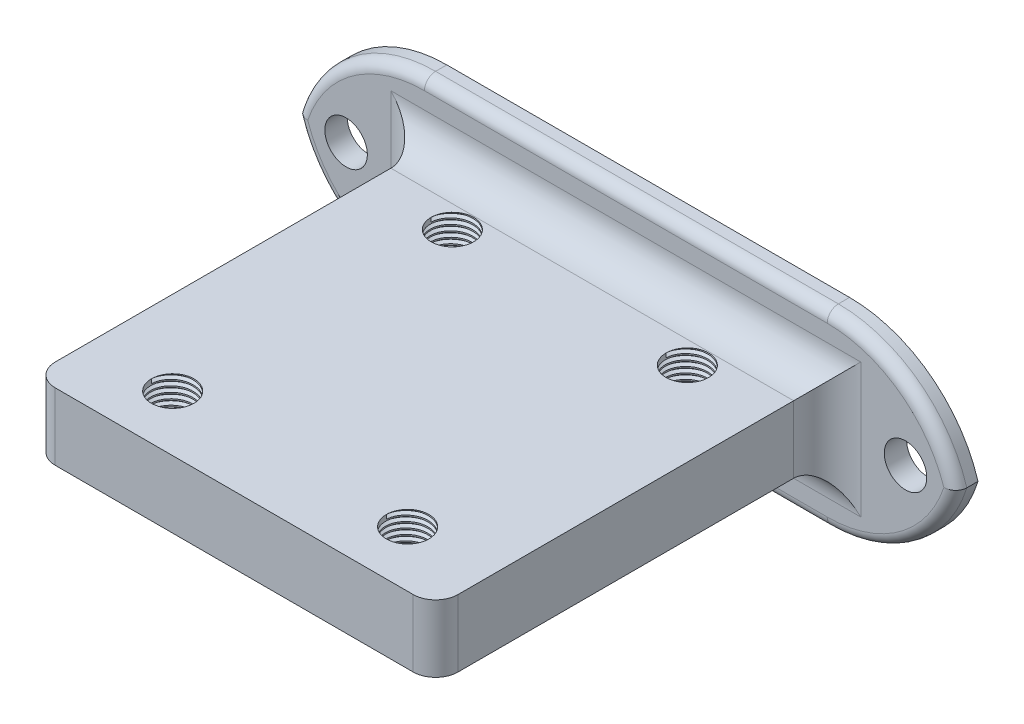
from build123d import *

# Parameters (mm, degrees)
CROQUIS1_W              = 36
CROQUIS1_H              = 6
SALIENTE_EXTRUIR1_DEPTH = 35
CROQUIS3_R              = 1.9
CORTAR_EXTRUIR1_DEPTH   = 40.812058475
CROQUIS4_W              = 60
CROQUIS4_H              = 17
SALIENTE_EXTRUIR2_DEPTH = 2
REDONDEO1_R             = 2
CROQUIS5_R              = 1.9
CORTAR_EXTRUIR2_DEPTH   = 47.874833333
REDONDEO2_R             = 3
REDONDEO4_R             = 12
REDONDEO3_R             = 1
ROSCA1_PITCH            = 0.5
ROSCA2_PITCH            = 0.5
ROSCA3_PITCH            = 0.5
ROSCA4_PITCH            = 0.5


with BuildPart() as part:
    # Croquis1 → Saliente-Extruir1 (new body)
    with BuildSketch(Plane.XY):
        Rectangle(CROQUIS1_W, CROQUIS1_H)
    extrude(amount=SALIENTE_EXTRUIR1_DEPTH)

    # Croquis3 → Cortar-Extruir1 (cut, through all)
    with BuildSketch(Plane.XZ.offset(3)):
        with Locations((-10.5, 30)):
            Circle(CROQUIS3_R)
        with Locations(Location((-10.5, 5, 0), (0, 0, 180))):
            Circle(CROQUIS3_R)
        with Locations((10.5, 5)):
            Circle(CROQUIS3_R)
        with Locations(Location((10.5, 30, 0), (0, 0, 180))):
            Circle(CROQUIS3_R)
    extrude(amount=-CORTAR_EXTRUIR1_DEPTH, mode=Mode.SUBTRACT)

    # Croquis4 → Saliente-Extruir2 (add)
    with BuildSketch(Plane(origin=(0, 0, -2), x_dir=(-1, 0, 0), z_dir=(0, 0, -1))):
        Rectangle(CROQUIS4_W, CROQUIS4_H)
    extrude(amount=-SALIENTE_EXTRUIR2_DEPTH)

    # Redondeo1
    redondeo1_edges = [part.edges().sort_by_distance(p)[0] for p in [
        (18, 0, 35),
        (-18, 0, 35),
    ]]
    fillet(redondeo1_edges, radius=REDONDEO1_R)

    # Croquis5 → Cortar-Extruir2 (cut, through all)
    with BuildSketch(Plane.XY):
        with Locations(Location((25, 0, 0), (0, 0, 180))):
            Circle(CROQUIS5_R)
        with Locations((-25, 0)):
            Circle(CROQUIS5_R)
    extrude(amount=-CORTAR_EXTRUIR2_DEPTH, mode=Mode.SUBTRACT)

    # Redondeo2
    redondeo2_edges = [part.edges().sort_by_distance(p)[0] for p in [
        (0, 3, 0),
        (18, 0, 0),
        (0, -3, 0),
        (-18, 0, 0),
    ]]
    fillet(redondeo2_edges, radius=REDONDEO2_R)

    # Redondeo4
    # the kernel refuses this fillet: 12 mm, written as the material it takes off along each edge
    with BuildSketch(Plane(origin=(-30, -8.5, -32), x_dir=(0, 1, 0), z_dir=(0, 0, 1)), Plane(origin=(-30, 8.5, -32), x_dir=(1, 0, 0), z_dir=(0, 0, 1))) as redondeo4_piece_1:
        with BuildLine():
            CenterArc((REDONDEO4_R, -REDONDEO4_R), REDONDEO4_R, 90, 90)
            Line((0, -REDONDEO4_R), (0, 0))
            Line((0, 0), (REDONDEO4_R, 0))
        make_face()
    extrude(amount=62, mode=Mode.SUBTRACT)
    with BuildSketch(Plane(origin=(30, -8.5, -32), x_dir=(0, 1, 0), z_dir=(0, 0, 1)), Plane(origin=(30, 8.5, -32), x_dir=(-1, 0, 0), z_dir=(0, 0, 1))) as redondeo4_piece_2:
        with BuildLine():
            CenterArc((REDONDEO4_R, REDONDEO4_R), REDONDEO4_R, 180, 90)
            Line((0, REDONDEO4_R), (0, 0))
            Line((0, 0), (REDONDEO4_R, 0))
        make_face()
    extrude(amount=62, mode=Mode.SUBTRACT)

    # Redondeo3
    redondeo3_edges = [part.edges().sort_by_distance(p)[0] for p in [
        (0, -8.5, 0),
        (0, 8.5, 0),
        (25.141428429, 6.143650761, 0),
        (25.141428429, -6.143650761, 0),
        (-25.141428429, 6.143650761, 0),
        (-25.141428429, -6.143650761, 0),
    ]]
    fillet(redondeo3_edges, radius=REDONDEO3_R)

    # Rosca1: the profile of Perfil de rosca1 profile screwed along a right-hand helix of 12 turns, 6 arcs to a turn; built about Z, then put on its axis
    rosca1_z = Axis((0, 0, 0), (0, 0, 1))
    rosca1_corners = [(1.8997, 0, -0.000173205), (2.170632937, 0, 0.156249999), (2.170632937, 0, 0.218749999), (1.8997, 0, 0.375173204)]
    with BuildLine(mode=Mode.PRIVATE) as rosca1_profile:
        Line(rosca1_corners[0], rosca1_corners[1])
        Line(rosca1_corners[1], rosca1_corners[2])
        Line(rosca1_corners[2], rosca1_corners[3])
        Line(rosca1_corners[3], rosca1_corners[0])
    rosca1_cap = Face(rosca1_profile.wire())
    rosca1_turn_angles = [0, 30, 60, 90, 120, 150, 180, 210, 240, 270, 300, 330, 360]
    rosca1_turn_weights = [1, 0.8660254037844387, 1, 0.8660254037844387, 1, 0.8660254037844387, 1, 0.8660254037844387, 1, 0.8660254037844387, 1, 0.8660254037844387, 1]
    rosca1_turn_rails = [Edge.make_bspline([Vector(p[0], p[1], 0).rotate(rosca1_z, rosca1_turn_angles[k]) / rosca1_turn_weights[k] + Vector(0, 0, p[2] + ROSCA1_PITCH * rosca1_turn_angles[k] / 360) for k in range(13)], [0, 0, 0, 1, 1, 2, 2, 3, 3, 4, 4, 5, 5, 6, 6, 6], 2, rosca1_turn_weights) for p in rosca1_corners]
    rosca1_turn_sides = [Face.make_surface_from_curves(rosca1_turn_rails[p[0]], rosca1_turn_rails[p[1]]) for p in [(0, 1), (1, 2), (2, 3), (3, 0)]]
    rosca1 = Plane(origin=(10.5, 3, 30), x_dir=(-1, 0, 0), z_dir=(0, -1, 0)) * Solid(Shell([*[p.moved(Location((0, 0, ROSCA1_PITCH * i))) for i in range(12) for p in rosca1_turn_sides], rosca1_cap, rosca1_cap.rotate(rosca1_z, 4320).moved(Location((0, 0, ROSCA1_PITCH * 4320 / 360)))]))
    add(rosca1, mode=Mode.SUBTRACT)

    # Rosca2: the profile of Perfil de rosca2 profile screwed along a right-hand helix of 12 turns, 6 arcs to a turn; built about Z, then put on its axis
    rosca2_z = Axis((0, 0, 0), (0, 0, 1))
    rosca2_corners = [(1.8997, 0, -0.000173205), (2.170632937, 0, 0.156249999), (2.170632937, 0, 0.218749999), (1.8997, 0, 0.375173204)]
    with BuildLine(mode=Mode.PRIVATE) as rosca2_profile:
        Line(rosca2_corners[0], rosca2_corners[1])
        Line(rosca2_corners[1], rosca2_corners[2])
        Line(rosca2_corners[2], rosca2_corners[3])
        Line(rosca2_corners[3], rosca2_corners[0])
    rosca2_cap = Face(rosca2_profile.wire())
    rosca2_turn_angles = [0, 30, 60, 90, 120, 150, 180, 210, 240, 270, 300, 330, 360]
    rosca2_turn_weights = [1, 0.8660254037844387, 1, 0.8660254037844387, 1, 0.8660254037844387, 1, 0.8660254037844387, 1, 0.8660254037844387, 1, 0.8660254037844387, 1]
    rosca2_turn_rails = [Edge.make_bspline([Vector(p[0], p[1], 0).rotate(rosca2_z, rosca2_turn_angles[k]) / rosca2_turn_weights[k] + Vector(0, 0, p[2] + ROSCA2_PITCH * rosca2_turn_angles[k] / 360) for k in range(13)], [0, 0, 0, 1, 1, 2, 2, 3, 3, 4, 4, 5, 5, 6, 6, 6], 2, rosca2_turn_weights) for p in rosca2_corners]
    rosca2_turn_sides = [Face.make_surface_from_curves(rosca2_turn_rails[p[0]], rosca2_turn_rails[p[1]]) for p in [(0, 1), (1, 2), (2, 3), (3, 0)]]
    rosca2 = Plane(origin=(-10.5, 3, 30), x_dir=(-1, 0, 0), z_dir=(0, -1, 0)) * Solid(Shell([*[p.moved(Location((0, 0, ROSCA2_PITCH * i))) for i in range(12) for p in rosca2_turn_sides], rosca2_cap, rosca2_cap.rotate(rosca2_z, 4320).moved(Location((0, 0, ROSCA2_PITCH * 4320 / 360)))]))
    add(rosca2, mode=Mode.SUBTRACT)

    # Rosca3: the profile of Perfil de rosca3 profile screwed along a right-hand helix of 12 turns, 6 arcs to a turn; built about Z, then put on its axis
    rosca3_z = Axis((0, 0, 0), (0, 0, 1))
    rosca3_corners = [(1.8997, 0, -0.000173205), (2.170632937, 0, 0.156249999), (2.170632937, 0, 0.218749999), (1.8997, 0, 0.375173204)]
    with BuildLine(mode=Mode.PRIVATE) as rosca3_profile:
        Line(rosca3_corners[0], rosca3_corners[1])
        Line(rosca3_corners[1], rosca3_corners[2])
        Line(rosca3_corners[2], rosca3_corners[3])
        Line(rosca3_corners[3], rosca3_corners[0])
    rosca3_cap = Face(rosca3_profile.wire())
    rosca3_turn_angles = [0, 30, 60, 90, 120, 150, 180, 210, 240, 270, 300, 330, 360]
    rosca3_turn_weights = [1, 0.8660254037844387, 1, 0.8660254037844387, 1, 0.8660254037844387, 1, 0.8660254037844387, 1, 0.8660254037844387, 1, 0.8660254037844387, 1]
    rosca3_turn_rails = [Edge.make_bspline([Vector(p[0], p[1], 0).rotate(rosca3_z, rosca3_turn_angles[k]) / rosca3_turn_weights[k] + Vector(0, 0, p[2] + ROSCA3_PITCH * rosca3_turn_angles[k] / 360) for k in range(13)], [0, 0, 0, 1, 1, 2, 2, 3, 3, 4, 4, 5, 5, 6, 6, 6], 2, rosca3_turn_weights) for p in rosca3_corners]
    rosca3_turn_sides = [Face.make_surface_from_curves(rosca3_turn_rails[p[0]], rosca3_turn_rails[p[1]]) for p in [(0, 1), (1, 2), (2, 3), (3, 0)]]
    rosca3 = Plane(origin=(-10.5, 3, 5), x_dir=(-1, 0, 0), z_dir=(0, -1, 0)) * Solid(Shell([*[p.moved(Location((0, 0, ROSCA3_PITCH * i))) for i in range(12) for p in rosca3_turn_sides], rosca3_cap, rosca3_cap.rotate(rosca3_z, 4320).moved(Location((0, 0, ROSCA3_PITCH * 4320 / 360)))]))
    add(rosca3, mode=Mode.SUBTRACT)

    # Rosca4: the profile of Perfil de rosca4 profile screwed along a right-hand helix of 12 turns, 6 arcs to a turn; built about Z, then put on its axis
    rosca4_z = Axis((0, 0, 0), (0, 0, 1))
    rosca4_corners = [(1.8997, 0, -0.000173205), (2.170632938, 0, 0.156249999), (2.170632938, 0, 0.218749999), (1.8997, 0, 0.375173204)]
    with BuildLine(mode=Mode.PRIVATE) as rosca4_profile:
        Line(rosca4_corners[0], rosca4_corners[1])
        Line(rosca4_corners[1], rosca4_corners[2])
        Line(rosca4_corners[2], rosca4_corners[3])
        Line(rosca4_corners[3], rosca4_corners[0])
    rosca4_cap = Face(rosca4_profile.wire())
    rosca4_turn_angles = [0, 30, 60, 90, 120, 150, 180, 210, 240, 270, 300, 330, 360]
    rosca4_turn_weights = [1, 0.8660254037844387, 1, 0.8660254037844387, 1, 0.8660254037844387, 1, 0.8660254037844387, 1, 0.8660254037844387, 1, 0.8660254037844387, 1]
    rosca4_turn_rails = [Edge.make_bspline([Vector(p[0], p[1], 0).rotate(rosca4_z, rosca4_turn_angles[k]) / rosca4_turn_weights[k] + Vector(0, 0, p[2] + ROSCA4_PITCH * rosca4_turn_angles[k] / 360) for k in range(13)], [0, 0, 0, 1, 1, 2, 2, 3, 3, 4, 4, 5, 5, 6, 6, 6], 2, rosca4_turn_weights) for p in rosca4_corners]
    rosca4_turn_sides = [Face.make_surface_from_curves(rosca4_turn_rails[p[0]], rosca4_turn_rails[p[1]]) for p in [(0, 1), (1, 2), (2, 3), (3, 0)]]
    rosca4 = Plane(origin=(10.5, 3, 5), x_dir=(-1, 0, 0), z_dir=(0, -1, 0)) * Solid(Shell([*[p.moved(Location((0, 0, ROSCA4_PITCH * i))) for i in range(12) for p in rosca4_turn_sides], rosca4_cap, rosca4_cap.rotate(rosca4_z, 4320).moved(Location((0, 0, ROSCA4_PITCH * 4320 / 360)))]))
    add(rosca4, mode=Mode.SUBTRACT)


solid = part.part
